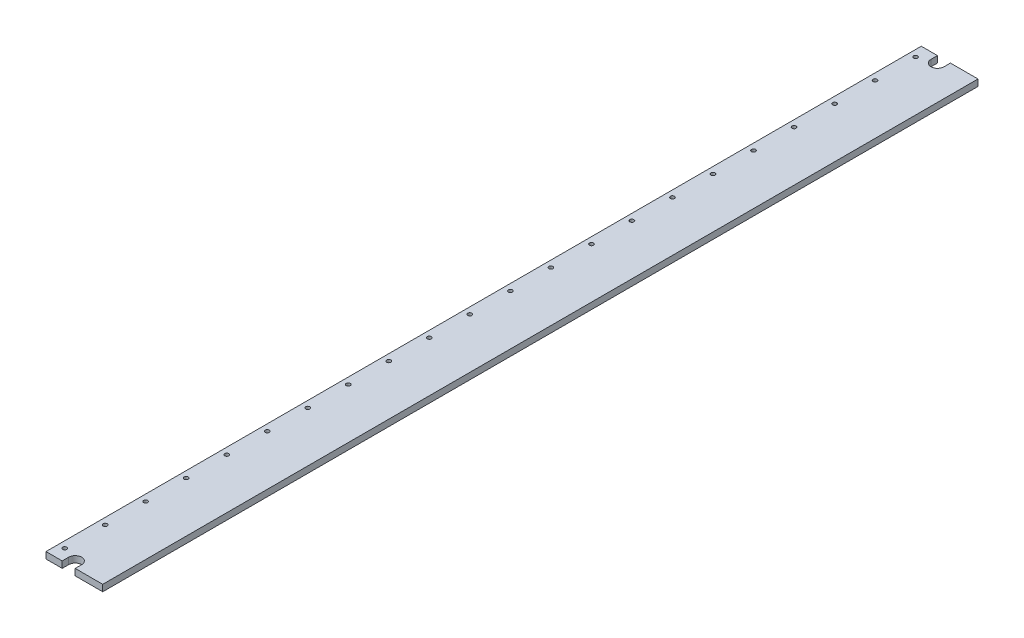
from build123d import *

# Parameters (mm, degrees)
SKETCH1_W           = 35
SKETCH1_H           = 4
BOSS_EXTRUDE1_DEPTH = 540
M3_TAPPED_HOLE1_D   = 2.5
LPATTERN1_COUNT     = 22
LPATTERN1_PITCH     = 25
CUT_EXTRUDE1_REACH  = 542.332


with BuildPart() as part:
    # Sketch1 → Boss-Extrude1 (new body)
    with BuildSketch(Plane.XY):
        with Locations((1, 0)):
            Rectangle(SKETCH1_W, SKETCH1_H)
    extrude(amount=BOSS_EXTRUDE1_DEPTH)

    # M3 Tapped Hole1 (through all)
    with Locations(Plane(origin=(-12.5, 2, 7.5), x_dir=(0, 0, 1), z_dir=(0, 1, 0))):
        with Locations((0, 0)):
            m3_tapped_hole1 = Hole(M3_TAPPED_HOLE1_D / 2)

    # LPattern1: M3 Tapped Hole1 ×22
    with Locations(*[(0, 0, i * LPATTERN1_PITCH) for i in range(1, LPATTERN1_COUNT)]):
        add(m3_tapped_hole1, mode=Mode.SUBTRACT)

    # Sketch4 → Cut-Extrude1 (cut, up to next)
    with BuildSketch(Plane(origin=(0, 2, 0), x_dir=(1, 0, 0), z_dir=(0, 1, 0)), mode=Mode.PRIVATE) as cut_extrude1_sk1:
        with BuildLine():
            Line((-6.5, 0), (-6.5, -4))
            ThreePointArc((-6.5, -4), (-2.5, -8), (1.5, -4))
            Line((1.5, -4), (1.5, 0))
            Line((1.5, 0), (-6.5, 0))
        make_face()
    cut_extrude1_tool1 = extrude(cut_extrude1_sk1.sketch, amount=-CUT_EXTRUDE1_REACH, mode=Mode.PRIVATE) & part.part
    # Sketch4 → Cut-Extrude1 (cut, up to next)
    with BuildSketch(Plane(origin=(0, 2, 0), x_dir=(1, 0, 0), z_dir=(0, 1, 0)), mode=Mode.PRIVATE) as cut_extrude1_sk2:
        with BuildLine():
            Line((-6.5, -540), (-6.5, -536))
            ThreePointArc((-6.5, -536), (-2.5, -532), (1.5, -536))
            Line((1.5, -536), (1.5, -540))
            Line((1.5, -540), (-6.5, -540))
        make_face()
    cut_extrude1_tool2 = extrude(cut_extrude1_sk2.sketch, amount=-CUT_EXTRUDE1_REACH, mode=Mode.PRIVATE) & part.part
    add(cut_extrude1_tool1.solids().sort_by_distance((-2.5, 2, 3.626601))[0], mode=Mode.SUBTRACT)
    add(cut_extrude1_tool2.solids().sort_by_distance((-2.5, 2, 536.373399))[0], mode=Mode.SUBTRACT)


solid = part.part
